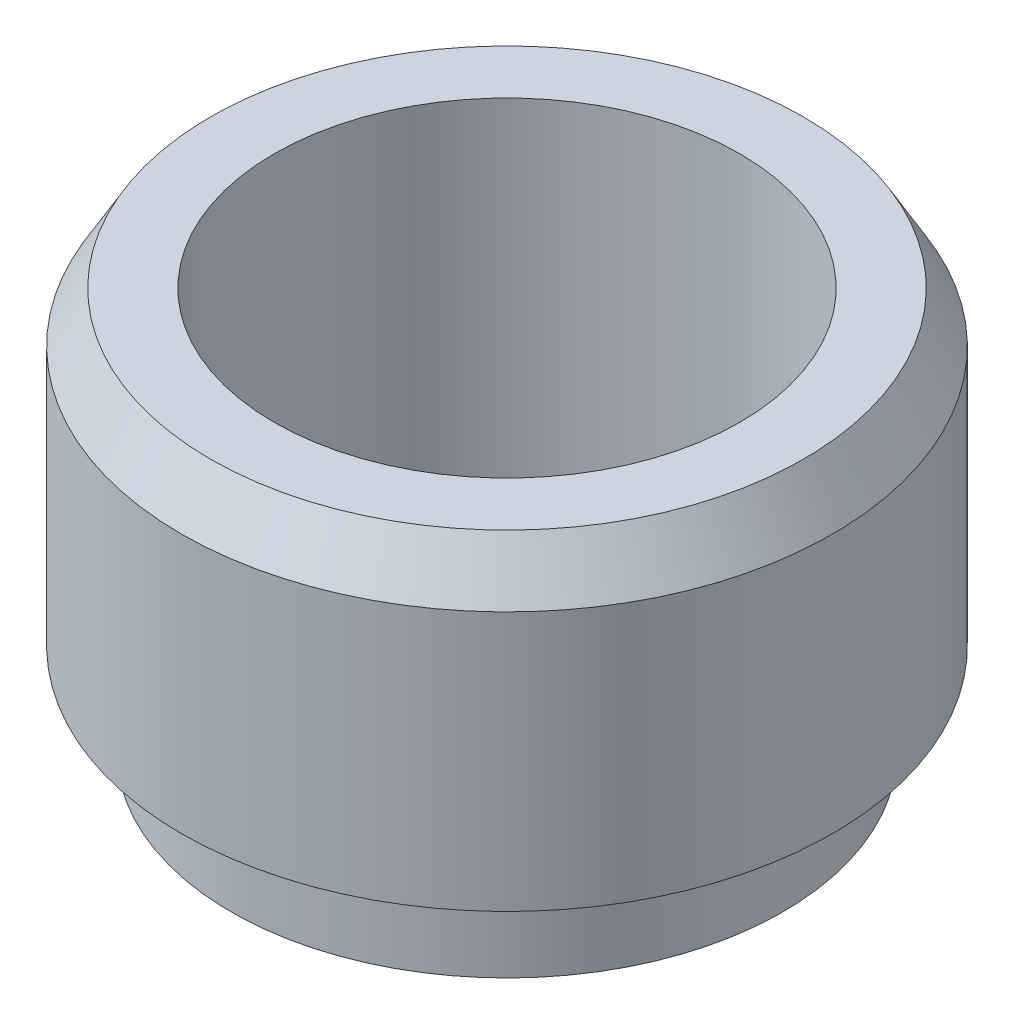
from build123d import *

# Parameters (mm, degrees)
SKETCH1_R           = 25.875
BOSS_EXTRUDE1_DEPTH = 32
SKETCH2_R           = 18.5
CUT_EXTRUDE1_DEPTH  = 32
CHAMFER1_SIZE       = 4
CHAMFER1_SIZE2      = 2.309401077
SKETCH3_R           = 29.308201054
SKETCH3_R_2         = 20.91202455
CUT_EXTRUDE2_DEPTH  = 7.38
SKETCH4_R           = 21.91202455
SKETCH4_R_2         = 20.91202455
BOSS_EXTRUDE2_DEPTH = 5


with BuildPart() as part:
    # Sketch1 → Boss-Extrude1 (new body)
    with BuildSketch(Plane(origin=(0, 0, 0), x_dir=(1, 0, 0), z_dir=(0, 1, 0))):
        Circle(SKETCH1_R)
    extrude(amount=BOSS_EXTRUDE1_DEPTH)

    # Sketch2 → Cut-Extrude1 (cut)
    with BuildSketch(Plane(origin=(0, 32, 0), x_dir=(1, 0, 0), z_dir=(0, 1, 0))):
        Circle(SKETCH2_R)
    extrude(amount=-CUT_EXTRUDE1_DEPTH, mode=Mode.SUBTRACT)

    # Chamfer1
    chamfer1_edges = [part.edges().sort_by_distance(p)[0] for p in [
        (-25.875, 32, 0),
    ]]
    chamfer1_side = [part.faces().sort_by_distance(p)[0] for p in [
        (-25.875, 16, 0),
    ]]
    chamfer(chamfer1_edges, length=CHAMFER1_SIZE, length2=CHAMFER1_SIZE2, reference=chamfer1_side[0])

    # Sketch3 → Cut-Extrude2 (cut)
    with BuildSketch(Plane.XZ):
        Circle(SKETCH3_R)
        Circle(SKETCH3_R_2, mode=Mode.SUBTRACT)
    extrude(amount=-CUT_EXTRUDE2_DEPTH, mode=Mode.SUBTRACT)

    # Sketch4 → Boss-Extrude2 (add)
    with BuildSketch(Plane.XZ):
        Circle(SKETCH4_R)
        Circle(SKETCH4_R_2, mode=Mode.SUBTRACT)
    extrude(amount=-BOSS_EXTRUDE2_DEPTH)


solid = part.part
